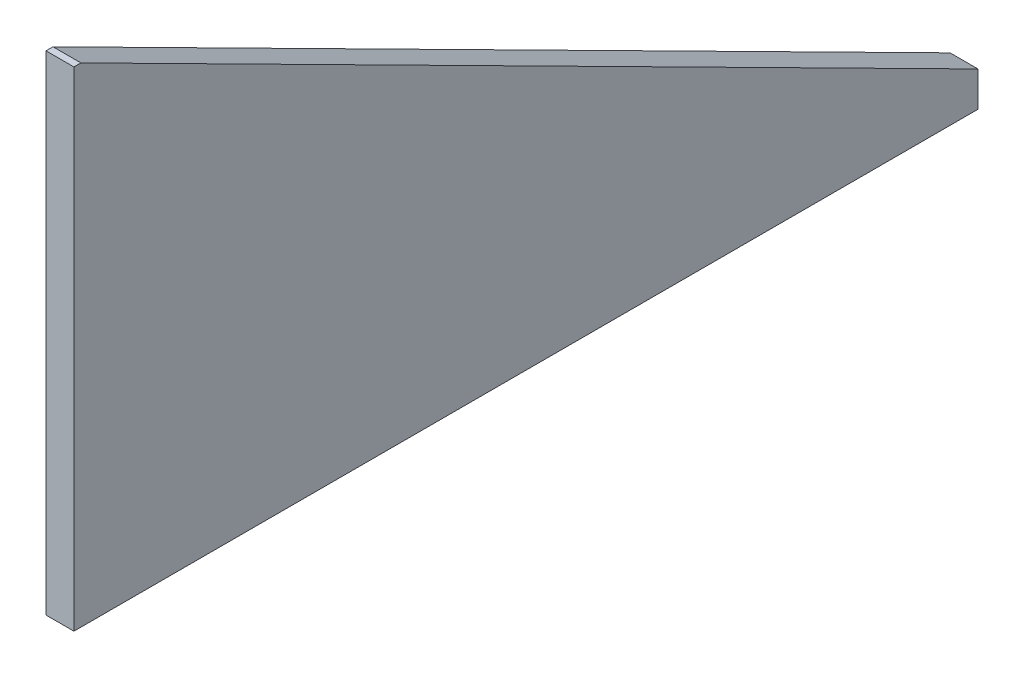
from build123d import *

# Parameters (mm, degrees)
SM_BASE_FLANGE_1_DEPTH = 16


# Sheet-metal steps are written as plain solids
with BuildPart() as part:
    # Sketch 1 → 基体-法兰1 (new body)
    with BuildSketch(Plane(origin=(0, 0, 0), x_dir=(0, 0, -1), z_dir=(1, 0, 0))):
        Polygon((0, 0), (0, 280), (4, 280), (518, 20), (518, 0), align=None)
    extrude(amount=-SM_BASE_FLANGE_1_DEPTH)


solid = part.part
